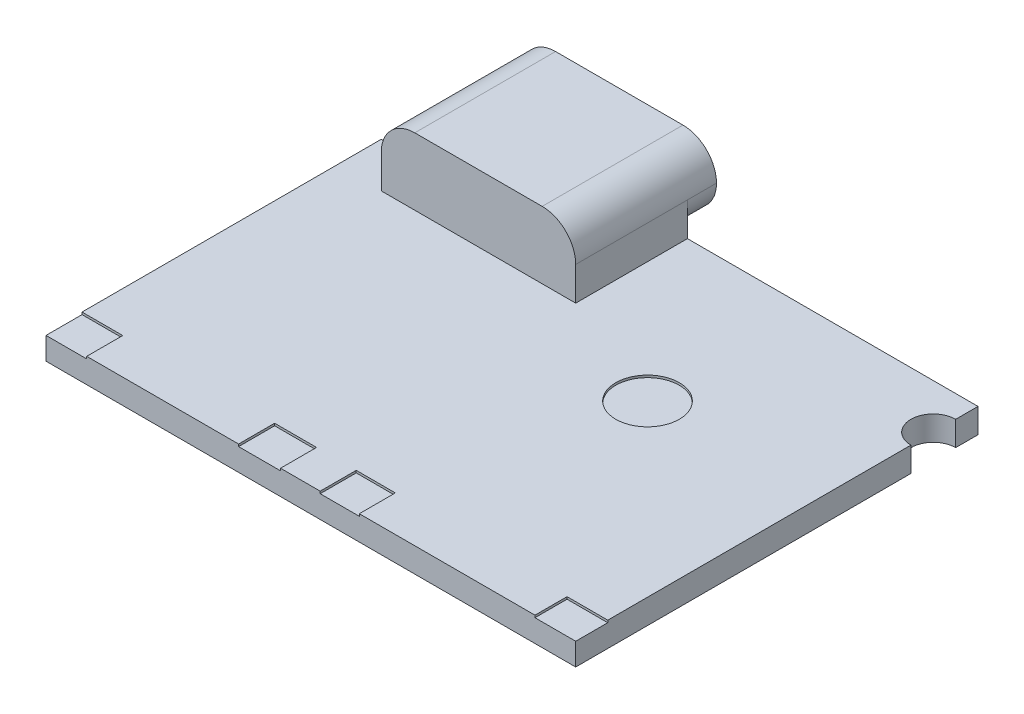
from build123d import *

# Parameters (mm, degrees)
ESBO_O1_W                = 23.7
ESBO_O1_H                = 18
RESSALTO_EXTRUS_O1_DEPTH = 1.1
ESBO_O2_W                = 8.7
ESBO_O2_H                = 6.3
RESSALTO_EXTRUS_O2_DEPTH = 3
FILETE1_R                = 1.5
ESBO_O3_R                = 1.420216844
ESBO_O3_W                = 1.821317375
ESBO_O3_H                = 1.611839717
ESBO_O3_W_2              = 1.876415965
ESBO_O3_W_3              = 1.749631103
ESBO_O3_H_2              = 1.434340909
CORTE_EXTRUS_O1_DEPTH    = 0.1
ESBO_O4_R                = 1
CORTE_EXTRUS_O2_DEPTH    = 31.711235729


with BuildPart() as part:
    # Esboço1 → Ressalto-extrusão1 (new body)
    with BuildSketch(Plane(origin=(0, 0, 0), x_dir=(1, 0, 0), z_dir=(0, 1, 0))):
        with Locations((11.85, 9)):
            Rectangle(ESBO_O1_W, ESBO_O1_H)
    extrude(amount=RESSALTO_EXTRUS_O1_DEPTH)

    # Esboço2 → Ressalto-extrusão2 (add)
    with BuildSketch(Plane(origin=(0, 1.1, 0), x_dir=(1, 0, 0), z_dir=(0, 1, 0))):
        with Locations((6.35, 16.15)):
            Rectangle(ESBO_O2_W, ESBO_O2_H)
    extrude(amount=RESSALTO_EXTRUS_O2_DEPTH)

    # Filete1
    filete1_edges = [part.edges().sort_by_distance(p)[0] for p in [
        (10.7, 1.1, -18.65),
        (2, 1.1, -18.65),
        (10.7, 4.1, -16.15),
        (2, 4.1, -16.15),
    ]]
    fillet(filete1_edges, radius=FILETE1_R - 0.0001)  # a hair under: the kernel refuses the full size

    # Esboço3 → Corte-extrusão1 (cut)
    with BuildSketch(Plane(origin=(0, 1.1, 0), x_dir=(1, 0, 0), z_dir=(0, 1, 0))):
        with Locations(Location((16.097292894, 10.816420735, 0), (0, 0, 270))):
            Circle(ESBO_O3_R)
        with Locations((0.910658688, 0.805919859)):
            Rectangle(ESBO_O3_W, ESBO_O3_H)
        with Locations((9.555193989, 0.805919859)):
            Rectangle(ESBO_O3_W_2, ESBO_O3_H)
        with Locations((13.143205597, 0.805919859)):
            Rectangle(ESBO_O3_W_3, ESBO_O3_H)
        with Locations((22.789341312, 0.717170455)):
            Rectangle(ESBO_O3_W, ESBO_O3_H_2)
    extrude(amount=-CORTE_EXTRUS_O1_DEPTH, mode=Mode.SUBTRACT)

    # Esboço4 → Corte-extrusão2 (cut, through all)
    with BuildSketch(Plane(origin=(0, 1.1, 0), x_dir=(1, 0, 0), z_dir=(0, 1, 0))):
        with Locations((0, 16)):
            Circle(ESBO_O4_R)
        with Locations((23.7, 16)):
            Circle(ESBO_O4_R)
    extrude(amount=-CORTE_EXTRUS_O2_DEPTH, mode=Mode.SUBTRACT)


solid = part.part
